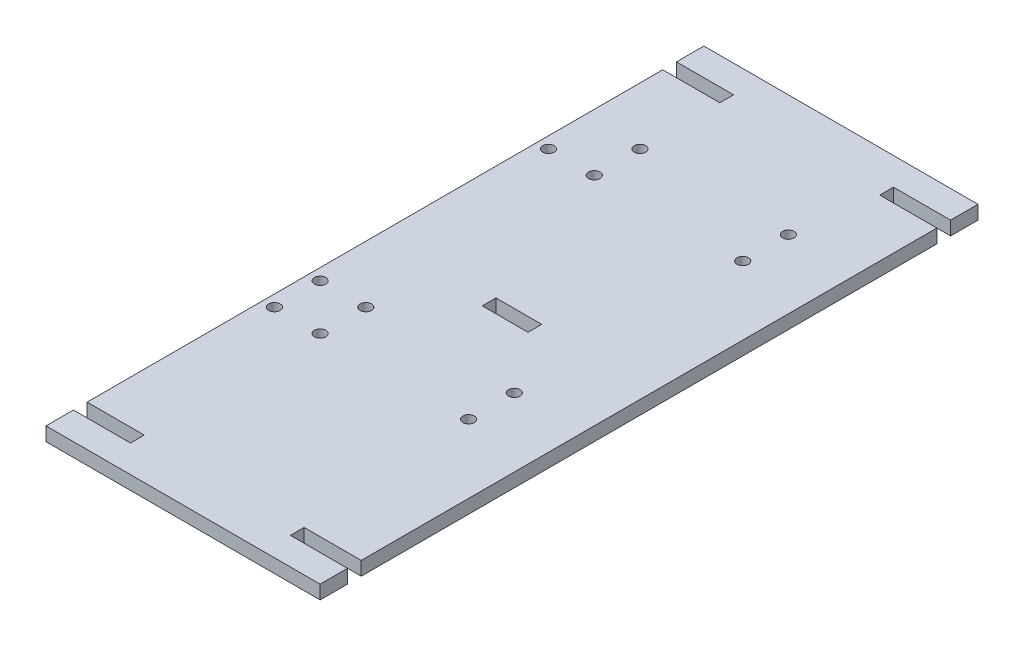
from build123d import *

# Parameters (mm, degrees)
SKETCH1_W            = 120
SKETCH1_H            = 288
BOSS_EXTRUDE1_DEPTH  = 6
SKETCH2_W            = 25
SKETCH2_H            = 6
CUT_EXTRUDE1_DEPTH   = 313.057686975
LPATTERN1_COUNT      = 2
LPATTERN1_PITCH      = 258
LPATTERN1_COUNT_DIR2 = 2
LPATTERN1_PITCH_DIR2 = 95
SKETCH3_W            = 20
SKETCH3_H            = 6
CUT_EXTRUDE2_DEPTH   = 10
SKETCH4_R            = 2.5
CUT_EXTRUDE4_DEPTH   = 10


with BuildPart() as part:
    # Sketch1 → Boss-Extrude1 (new body)
    with BuildSketch(Plane(origin=(0, 0, 0), x_dir=(1, 0, 0), z_dir=(0, 1, 0))):
        with Locations((-60, 144)):
            Rectangle(SKETCH1_W, SKETCH1_H)
    extrude(amount=BOSS_EXTRUDE1_DEPTH)

    # Sketch2 → Cut-Extrude1 (cut, through all)
    with BuildSketch(Plane(origin=(0, 6, 0), x_dir=(1, 0, 0), z_dir=(0, 1, 0))):
        with Locations((-107.5, 273)):
            Rectangle(SKETCH2_W, SKETCH2_H)
    cut_extrude1 = extrude(amount=-CUT_EXTRUDE1_DEPTH, mode=Mode.SUBTRACT)

    # LPattern1: Cut-Extrude1 2 × 2
    with Locations(*[(j * LPATTERN1_PITCH_DIR2, 0, i * LPATTERN1_PITCH) for i in range(LPATTERN1_COUNT) for j in range(LPATTERN1_COUNT_DIR2) if (i, j) != (0, 0)]):
        add(cut_extrude1, mode=Mode.SUBTRACT)

    # Sketch3 → Cut-Extrude2 (cut)
    with BuildSketch(Plane(origin=(0, 6, 0), x_dir=(1, 0, 0), z_dir=(0, 1, 0))):
        with Locations((-60, 144)):
            Rectangle(SKETCH3_W, SKETCH3_H)
    extrude(amount=-CUT_EXTRUDE2_DEPTH, mode=Mode.SUBTRACT)

    # Sketch4 → Cut-Extrude4 (cut)
    with BuildSketch(Plane(origin=(0, 6, 0), x_dir=(1, 0, 0), z_dir=(0, 1, 0))):
        with Locations((-30, 235)):
            Circle(SKETCH4_R)
        with Locations((-30, 215)):
            Circle(SKETCH4_R)
        with Locations((-95, 235)):
            Circle(SKETCH4_R)
        with Locations((-95, 215)):
            Circle(SKETCH4_R)
        with Locations((-115, 215)):
            Circle(SKETCH4_R)
        with Locations((-95, 115)):
            Circle(SKETCH4_R)
        with Locations((-115, 115)):
            Circle(SKETCH4_R)
        with Locations((-95, 95)):
            Circle(SKETCH4_R)
        with Locations((-30, 115)):
            Circle(SKETCH4_R)
        with Locations((-30, 95)):
            Circle(SKETCH4_R)
        with Locations((-115, 95)):
            Circle(SKETCH4_R)
    extrude(amount=-CUT_EXTRUDE4_DEPTH, mode=Mode.SUBTRACT)


solid = part.part
